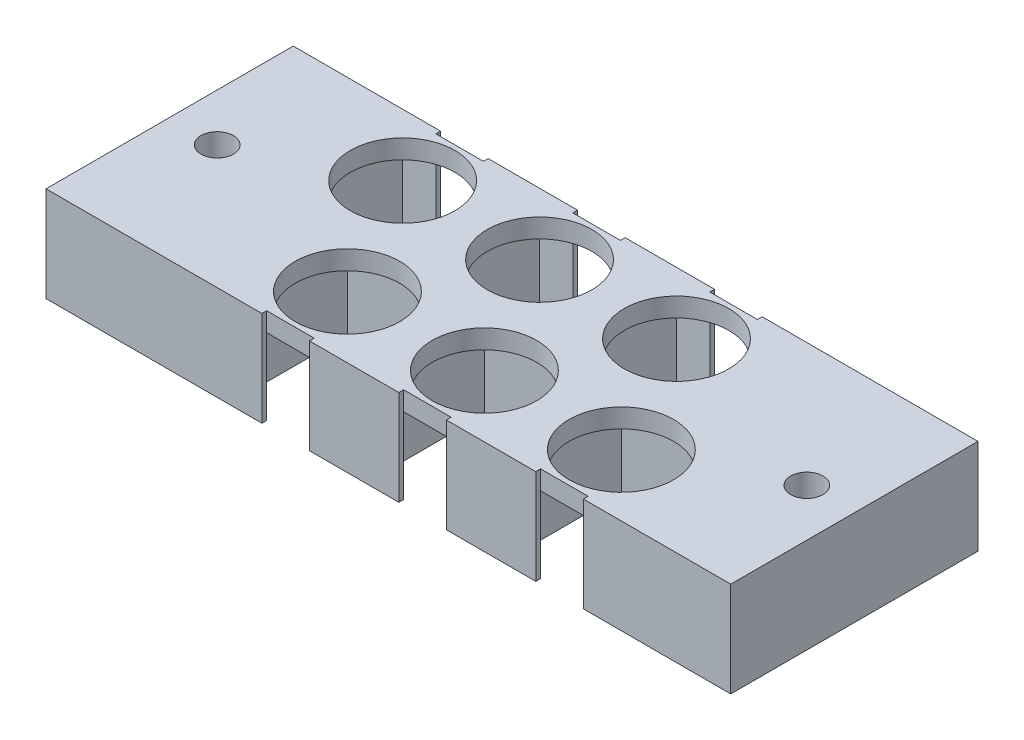
from build123d import *

# Parameters (mm, degrees)
SKETCH1_R             = 5.5
BOSS_EXTRUDE1_DEPTH   = 2
BOSS_EXTRUDE1_2_DEPTH = 2
BOSS_EXTRUDE1_3_DEPTH = 2
BOSS_EXTRUDE1_4_DEPTH = 2
BOSS_EXTRUDE1_5_DEPTH = 2
BOSS_EXTRUDE1_6_DEPTH = 2
SKETCH1_4_R           = 1.7
BOSS_EXTRUDE2_DEPTH   = 10
CUT_EXTRUDE2_DEPTH    = 1


with BuildPart() as part:
    # Sketch1 → Boss-Extrude1 (new body)
    with BuildSketch(Plane(origin=(0, 0, 0), x_dir=(1, 0, 0), z_dir=(0, 1, 0))):
        Polygon((5.686387511, -4.664883005), (-6.313612489, -4.664882988), (-6.313612506, -16.664882988), (5.686387494, -16.664883005), align=None)
        with Locations((-0.313612497, -10.664882997)):
            Circle(SKETCH1_R, mode=Mode.SUBTRACT)
    extrude(amount=-BOSS_EXTRUDE1_DEPTH)



with BuildPart() as body_2:
    # Sketch1 → Boss-Extrude1 2 (new body)
    with BuildSketch(Plane(origin=(0, 0, 0), x_dir=(1, 0, 0), z_dir=(0, 1, 0))):
        Polygon((20.086387511, -4.664883026), (8.086387511, -4.664883009), (8.086387494, -16.664883009), (20.086387494, -16.664883026), align=None)
        with Locations((14.086387503, -10.664883017)):
            Circle(SKETCH1_R, mode=Mode.SUBTRACT)
    extrude(amount=-BOSS_EXTRUDE1_2_DEPTH)


with BuildPart() as body_3:
    # Sketch1 → Boss-Extrude1 3 (new body)
    with BuildSketch(Plane(origin=(0, 0, 0), x_dir=(1, 0, 0), z_dir=(0, 1, 0))):
        Polygon((0.886387474, -29.664882999), (12.886387474, -29.664883016), (12.886387491, -17.664883016), (0.886387491, -17.664882999), align=None)
        with Locations((6.886387483, -23.664883007)):
            Circle(SKETCH1_R, mode=Mode.SUBTRACT)
    extrude(amount=-BOSS_EXTRUDE1_3_DEPTH)


with BuildPart() as body_4:
    # Sketch1 → Boss-Extrude1 4 (new body)
    with BuildSketch(Plane(origin=(0, 0, 0), x_dir=(1, 0, 0), z_dir=(0, 1, 0))):
        Polygon((15.286387474, -29.664883019), (27.286387474, -29.664883036), (27.286387491, -17.664883036), (15.286387491, -17.664883019), align=None)
        with Locations((21.286387483, -23.664883027)):
            Circle(SKETCH1_R, mode=Mode.SUBTRACT)
    extrude(amount=-BOSS_EXTRUDE1_4_DEPTH)


with BuildPart() as body_5:
    # Sketch1 → Boss-Extrude1 5 (new body)
    with BuildSketch(Plane(origin=(0, 0, 0), x_dir=(1, 0, 0), z_dir=(0, 1, 0))):
        Polygon((34.486387511, -4.664883046), (22.486387511, -4.664883029), (22.486387494, -16.664883029), (34.486387494, -16.664883046), align=None)
        with Locations((28.486387503, -10.664883038)):
            Circle(SKETCH1_R, mode=Mode.SUBTRACT)
    extrude(amount=-BOSS_EXTRUDE1_5_DEPTH)


with BuildPart() as body_6:
    # Sketch1 → Boss-Extrude1 6 (new body)
    with BuildSketch(Plane(origin=(0, 0, 0), x_dir=(1, 0, 0), z_dir=(0, 1, 0))):
        Polygon((29.686387474, -29.664883039), (41.686387474, -29.664883056), (41.686387491, -17.664883056), (29.686387491, -17.664883039), align=None)
        with Locations((35.686387483, -23.664883048)):
            Circle(SKETCH1_R, mode=Mode.SUBTRACT)
    extrude(amount=-BOSS_EXTRUDE1_6_DEPTH)


with BuildPart() as part_1:
    add(part.part)

    add(body_2.part)  # Boss-Extrude2 merges body 2

    add(body_3.part)  # Boss-Extrude2 merges body 3

    add(body_4.part)  # Boss-Extrude2 merges body 4

    add(body_5.part)  # Boss-Extrude2 merges body 5

    add(body_6.part)  # Boss-Extrude2 merges body 6
    # Sketch1<4> → Boss-Extrude2 (add)
    with BuildSketch(Plane(origin=(0, 0, 0), x_dir=(1, 0, 0), z_dir=(0, 1, 0))):
        Polygon((7.586387521, -4.164883013), (2.186387512, -4.164883), (2.186387511, -4.664883), (5.686387511, -4.664883005), (5.686387494, -16.664883005), (-6.313612506, -16.664882988), (-6.313612489, -4.664882988), (-2.813612489, -4.664882993), (-2.813612488, -4.164882993), (-6.813612488, -4.164882988), (-18.31361246, -4.164883002), (-18.31361246, -30.164883012), (0.386387502, -30.164883012), (4.386387474, -30.164883004), (4.386387474, -29.664883004), (0.886387474, -29.664882999), (0.886387491, -17.664882999), (12.886387491, -17.664883016), (12.886387474, -29.664883016), (9.386387474, -29.664883011), (9.386387474, -30.164883011), (13.386387474, -30.164883016), (14.786387502, -30.164883033), (18.786387474, -30.164883024), (18.786387474, -29.664883024), (15.286387474, -29.664883019), (15.286387491, -17.664883019), (27.286387491, -17.664883036), (27.286387474, -29.664883036), (23.786387474, -29.664883031), (23.786387474, -30.164883031), (27.786387474, -30.164883037), (29.186387502, -30.164883053), (33.186387474, -30.164883044), (33.186387474, -29.664883044), (29.686387474, -29.664883039), (29.686387491, -17.664883039), (41.686387491, -17.664883056), (41.686387474, -29.664883056), (38.186387474, -29.664883051), (38.186387474, -30.164883051), (42.186387474, -30.164883057), (53.686387503, -30.164883012), (53.686387503, -4.164883002), (34.98638754, -4.164883061), (30.986387512, -4.164883041), (30.986387511, -4.664883041), (34.486387511, -4.664883046), (34.486387494, -16.664883046), (22.486387494, -16.664883029), (22.486387511, -4.664883029), (25.986387511, -4.664883034), (25.986387512, -4.164883034), (21.986387512, -4.164883028), (20.58638754, -4.164883041), (16.586387512, -4.164883021), (16.586387511, -4.664883021), (20.086387511, -4.664883026), (20.086387494, -16.664883026), (8.086387494, -16.664883009), (8.086387511, -4.664883009), (11.586387511, -4.664883014), (11.586387512, -4.164883014), align=None)
        with Locations((-13.31361246, -17.164883007)):
            Circle(SKETCH1_4_R, mode=Mode.SUBTRACT)
        with Locations((48.68638754, -17.164883007)):
            Circle(SKETCH1_4_R, mode=Mode.SUBTRACT)
    extrude(amount=-BOSS_EXTRUDE2_DEPTH)

    # Sketch4 → Cut-Extrude2 (cut)
    with BuildSketch(Plane.XZ.offset(10)):
        Polygon((-9.718963701, 26.127659521), (-8.172168829, 26.127659521), (-8.172168829, 25.802018495), (-9.434027803, 25.802018495), (-9.434027803, 24.825095419), (-8.172168829, 24.825095419), (-8.172168829, 24.499454393), (-9.434027803, 24.499454393), (-9.434027803, 22.952659521), (-9.718963701, 22.952659521), align=None)
        Polygon((-7.212418228, 26.127659521), (-6.625373957, 26.127659521), (-6.625373957, 22.952659521), (-6.910309854, 22.952659521), (-6.910309854, 25.802018495), (-7.398771393, 25.802018495), align=None)
    extrude(amount=-CUT_EXTRUDE2_DEPTH, mode=Mode.SUBTRACT)


solid = part_1.part
